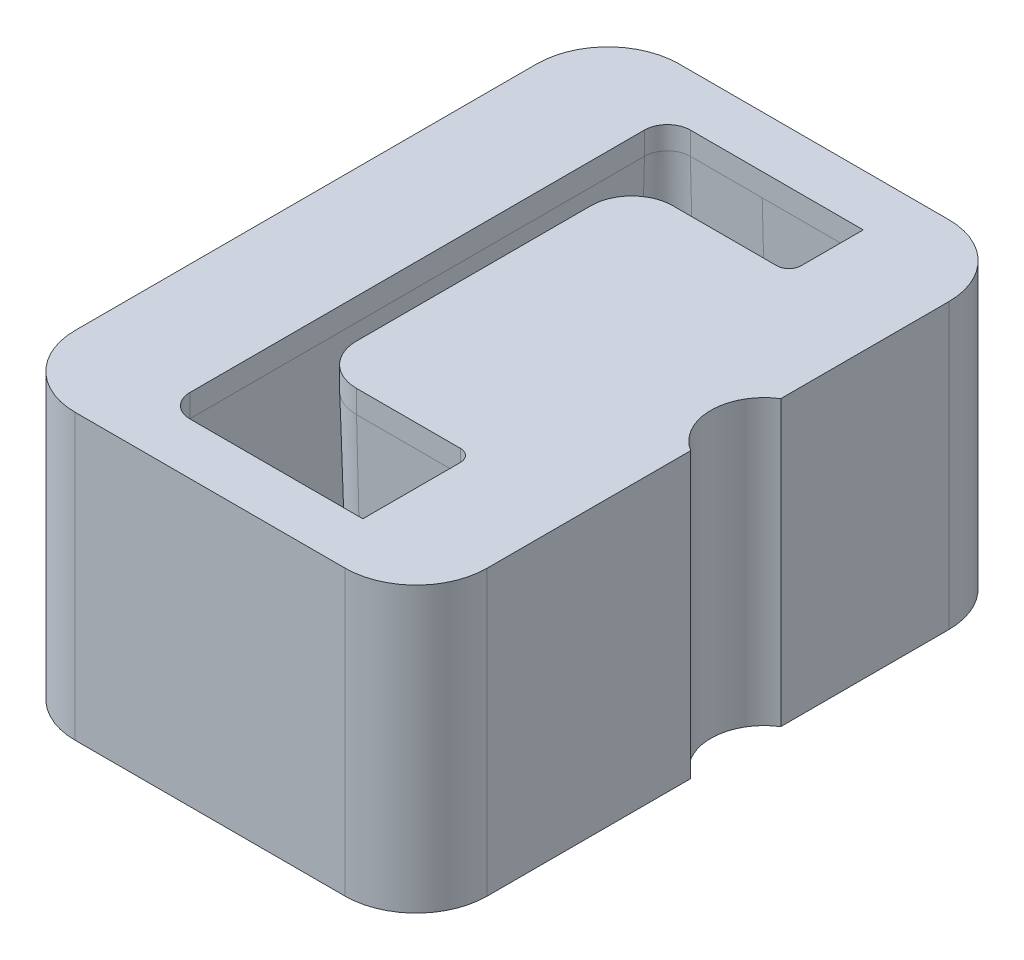
from build123d import *

# Parameters (mm, degrees)
SKETCH1_W                   = 58
SKETCH1_H                   = 85
BOSS_EXTRUDE1_DEPTH         = 40
FILLET1_R                   = 10
CUT_EXTRUDE1_REACH          = 67.171
M6_TAPPED_HOLE1_D           = 5
M6_TAPPED_HOLE1_DEPTH       = 17
M6_TAPPED_HOLE1_CSINK_D     = 6.05
M6_TAPPED_HOLE1_CSINK_ANGLE = 90
M6_TAPPED_HOLE1_TIP         = 1.502151548
SKETCH9_R                   = 7.5
CUT_EXTRUDE2_DEPTH          = 333.145792236


with BuildPart() as part:
    # Sketch1 → Boss-Extrude1 (new body)
    with BuildSketch(Plane(origin=(0, 0, 0), x_dir=(1, 0, 0), z_dir=(0, 1, 0))):
        Rectangle(SKETCH1_W, SKETCH1_H)
    extrude(amount=-BOSS_EXTRUDE1_DEPTH)

    # Fillet1
    fillet1_edges = [part.edges().sort_by_distance(p)[0] for p in [
        (-29, -20, -42.5),
        (29, -20, -42.5),
        (29, -20, 42.5),
        (-29, -20, 42.5),
    ]]
    fillet(fillet1_edges, radius=FILLET1_R)

    # Sketch2 → Cut-Extrude1 (cut, up to next)
    with BuildSketch(Plane(origin=(0, 0, 0), x_dir=(1, 0, 0), z_dir=(0, 1, 0)), mode=Mode.PRIVATE) as cut_extrude1_sk1:
        with BuildLine():
            Line((14.23, 35.23), (-10.12, 35.23))
            ThreePointArc((-10.12, 35.23), (-12.403954903, 34.283954903), (-13.35, 32))
            Line((-13.35, 32), (-13.35, -32))
            ThreePointArc((-13.35, -32), (-12.403954903, -34.283954903), (-10.12, -35.23))
            Line((-10.12, -35.23), (14.23, -35.23))
            Line((14.23, -35.23), (14.23, -21.5))
            ThreePointArc((14.23, -21.5), (13.723294731, -20.276705269), (12.5, -19.77))
            Line((12.5, -19.77), (-2.12, -19.77))
            ThreePointArc((-2.12, -19.77), (-6.200006127, -18.080006127), (-7.89, -14))
            Line((-7.89, -14), (-7.89, 19))
            ThreePointArc((-7.89, 19), (-6.200006127, 23.080006127), (-2.12, 24.77))
            Line((-2.12, 24.77), (12.5, 24.77))
            ThreePointArc((12.5, 24.77), (13.723294731, 25.276705269), (14.23, 26.5))
            Line((14.23, 26.5), (14.23, 35.23))
        make_face()
    cut_extrude1_tool1 = extrude(cut_extrude1_sk1.sketch, amount=-CUT_EXTRUDE1_REACH, mode=Mode.PRIVATE) & part.part
    add(cut_extrude1_tool1.solids().sort_by_distance((-6.735042, 0, -23.615042))[0], mode=Mode.SUBTRACT)

    # Cut-Sweep1: sweep along a path in Sketch5
    with BuildLine(Plane(origin=(0, 0, 0), x_dir=(1, 0, 0), z_dir=(0, 1, 0))) as cut_sweep1_path:
        Line((12.5, -19.77), (-2.12, -19.77))
        ThreePointArc((-2.12, -19.77), (-6.200006127, -18.080006127), (-7.89, -14))
        Line((-7.89, -14), (-7.89, 19))
        ThreePointArc((-7.89, 19), (-6.200006127, 23.080006127), (-2.12, 24.77))
        Line((-2.12, 24.77), (12.5, 24.77))
        ThreePointArc((12.5, 24.77), (13.723294731, 25.276705269), (14.23, 26.5))
        Line((14.23, 26.5), (14.23, 35.23))
        Line((14.23, 35.23), (-10.12, 35.23))
        ThreePointArc((-10.12, 35.23), (-12.403954903, 34.283954903), (-13.35, 32))
        Line((-13.35, 32), (-13.35, -32))
        ThreePointArc((-13.35, -32), (-12.403954903, -34.283954903), (-10.12, -35.23))
        Line((-10.12, -35.23), (14.23, -35.23))
        Line((14.23, -35.23), (14.23, -21.5))
        ThreePointArc((14.23, -21.5), (13.723294731, -20.276705269), (12.5, -19.77))
    # Sketch3 → Cut-Sweep1 (sweep, cut)
    with BuildSketch(Plane(origin=(0, 0, 0), x_dir=(0, 0, -1), z_dir=(1, 0, 0))):
        Polygon((35.23, -3.2), (36.193641914, -40), (35.23, -40), align=None)
    sweep(path=cut_sweep1_path.line, transition=Transition.RIGHT, mode=Mode.SUBTRACT)

    # M6 Tapped Hole1
    with Locations(Plane(origin=(0, -40, 0), x_dir=(-1, 0, 0), z_dir=(0, -1, 0))):
        with Locations((-22, 35.5), (22, 35.5), (22, -35.5), (-22, -35.5)):
            CounterSinkHole(M6_TAPPED_HOLE1_D / 2, M6_TAPPED_HOLE1_CSINK_D / 2, depth=M6_TAPPED_HOLE1_DEPTH, counter_sink_angle=M6_TAPPED_HOLE1_CSINK_ANGLE)
            with Locations((0, 0, -(M6_TAPPED_HOLE1_DEPTH + M6_TAPPED_HOLE1_TIP / 2))):  # 118° drill point
                Cone(0, M6_TAPPED_HOLE1_D / 2, M6_TAPPED_HOLE1_TIP, mode=Mode.SUBTRACT)

    # Sketch9 → Cut-Extrude2 (cut, through all)
    with BuildSketch(Plane(origin=(296.88, 0, 7.73), x_dir=(1, 0, 0), z_dir=(0, 1, 0))):
        with Locations((-263.88, 10.23)):
            Circle(SKETCH9_R)
    extrude(amount=-CUT_EXTRUDE2_DEPTH, mode=Mode.SUBTRACT)


solid = part.part
